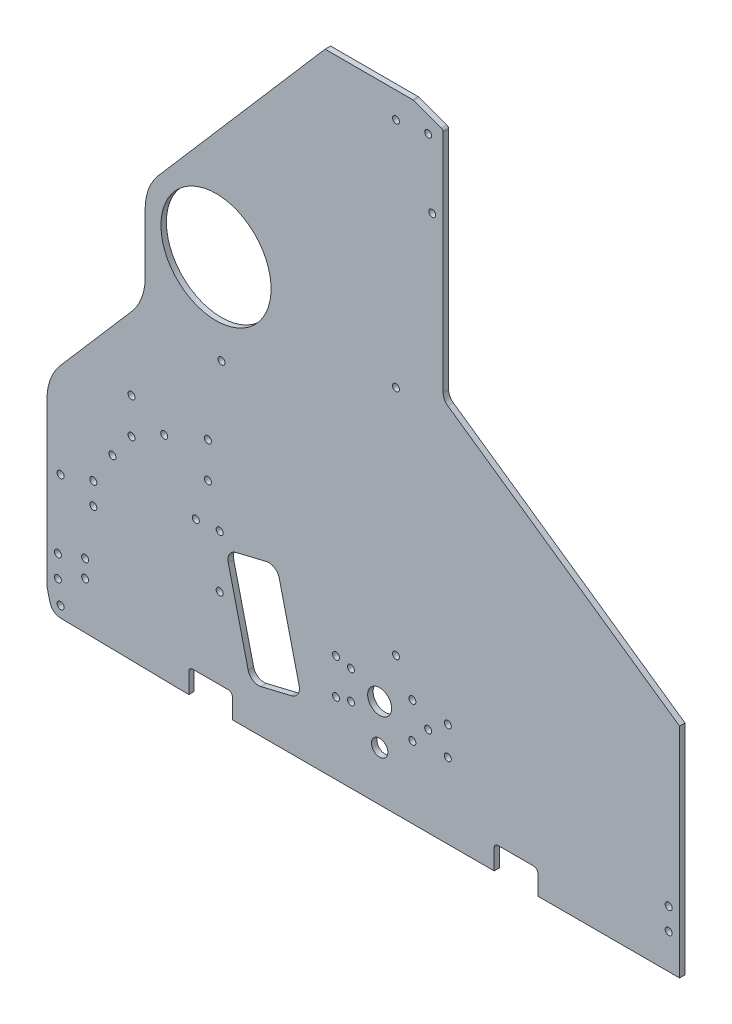
from build123d import *

# Parameters (mm, degrees)
SKETCH1_R           = 2.032
SKETCH1_R_2         = 2
BOSS_EXTRUDE1_DEPTH = 3.175
FILLET1_R           = 2.286
FILLET2_R           = 6.35
SKETCH2_R           = 2.032
CUT_EXTRUDE1_DEPTH  = 505.524983177
FILLET3_R           = 1.5875
SKETCH3_R           = 2.032
CUT_EXTRUDE2_DEPTH  = 505.524983177
SKETCH4_R           = 2.032
SKETCH4_R_2         = 6.985
SKETCH4_R_3         = 4.7625
CUT_EXTRUDE3_DEPTH  = 505.524983177
SKETCH5_R           = 32.0675
CUT_EXTRUDE5_DEPTH  = 540.282511023
FILLET4_R           = 31.75


with BuildPart() as part:
    # Sketch1 → Boss-Extrude1 (new body)
    with BuildSketch(Plane.XY):
        with BuildLine():
            Line((7.829508682, -19.049081656), (82.55, -20.32))
            Line((82.55, -20.32), (82.55, -6.35))
            Line((82.55, -6.35), (107.95, -6.35))
            Line((107.95, -6.35), (107.95, -20.32))
            Line((107.95, -20.32), (260.35, -20.32))
            Line((260.35, -20.32), (260.35, -6.35))
            Line((260.35, -6.35), (285.75, -6.35))
            Line((285.75, -6.35), (285.75, -20.32))
            Line((285.75, -20.32), (368.3, -20.32))
            Line((368.3, -20.32), (368.3, 106.68))
            Line((368.3, 106.68), (230.66375, 202.565))
            Line((230.66375, 202.565), (230.66375, 338.455))
            Line((230.66375, 338.455), (213.19998, 344.805))
            Line((213.19998, 344.805), (203.2, 344.805))
            Line((203.2, 344.805), (161.925, 344.805))
            Line((161.925, 344.805), (52.720122664, 218.469945827))
            ThreePointArc((52.720122664, 218.469945827), (52.803835479, 218.142145922), (52.832, 217.805))
            ThreePointArc((52.832, 217.805), (52.095493096, 216.239521914), (50.419872403, 215.808871996))
            Line((50.419872403, 215.808871996), (0, 157.48))
            Line((0, 157.48), (0, 0))
            Line((0, 0), (0, -6.35))
            ThreePointArc((0, -6.35), (0.047577015, -7.125863724), (0.189595124, -7.890101219))
            Line((0.189595124, -7.890101219), (1.777095124, -14.240101219))
            ThreePointArc((1.777095124, -14.240101219), (3.987212552, -17.671692778), (7.829508682, -19.049081656))
        make_face()
        with Locations((7.9375, -12.7)):
            Circle(SKETCH1_R, mode=Mode.SUBTRACT)
        with Locations((6.35, 0)):
            Circle(SKETCH1_R, mode=Mode.SUBTRACT)
        with Locations((6.35, 12.7)):
            Circle(SKETCH1_R, mode=Mode.SUBTRACT)
        with Locations((86.67844474, 70.151394807)):
            Circle(SKETCH1_R, mode=Mode.SUBTRACT)
        with Locations((38.1, 78.105)):
            Circle(SKETCH1_R, mode=Mode.SUBTRACT)
        with Locations((49.2125, 93.18625)):
            Circle(SKETCH1_R, mode=Mode.SUBTRACT)
        with Locations((68.2625, 103.505)):
            Circle(SKETCH1_R, mode=Mode.SUBTRACT)
        with Locations((49.2125, 113.82375)):
            Circle(SKETCH1_R, mode=Mode.SUBTRACT)
        with Locations((93.6625, 93.18625)):
            Circle(SKETCH1_R, mode=Mode.SUBTRACT)
        with Locations((93.6625, 113.82375)):
            Circle(SKETCH1_R, mode=Mode.SUBTRACT)
        with Locations((101.6, 157.48)):
            Circle(SKETCH1_R, mode=Mode.SUBTRACT)
        with Locations((203.2, 59.805)):
            Circle(SKETCH1_R_2, mode=Mode.SUBTRACT)
        with Locations((361.95, 0)):
            Circle(SKETCH1_R, mode=Mode.SUBTRACT)
        with Locations((361.95, 12.7)):
            Circle(SKETCH1_R, mode=Mode.SUBTRACT)
        with Locations((76.2, 217.805)):
            Circle(SKETCH1_R, mode=Mode.SUBTRACT)
        with Locations((203.2, 194.805)):
            Circle(SKETCH1_R_2, mode=Mode.SUBTRACT)
        with Locations((224.31375, 293.243)):
            Circle(SKETCH1_R, mode=Mode.SUBTRACT)
        with Locations((203.2, 329.805)):
            Circle(SKETCH1_R_2, mode=Mode.SUBTRACT)
        with Locations((221.931865, 332.105)):
            Circle(SKETCH1_R_2, mode=Mode.SUBTRACT)
    extrude(amount=BOSS_EXTRUDE1_DEPTH)

    # Fillet1
    fillet1_edges = [part.edges().sort_by_distance(p)[0] for p in [
        (285.75, -6.35, 1.5875),
        (107.95, -6.35, 1.5875),
        (260.35, -6.35, 1.5875),
        (82.55, -6.35, 1.5875),
    ]]
    fillet(fillet1_edges, radius=FILLET1_R)

    # Fillet2
    fillet2_edges = [part.edges().sort_by_distance(p)[0] for p in [
        (230.66375, 202.565, 1.5875),
    ]]
    fillet(fillet2_edges, radius=FILLET2_R)

    # Sketch2 → Cut-Extrude1 (cut, through all)
    with BuildSketch(Plane(origin=(0, 0, 0), x_dir=(-1, 0, 0), z_dir=(0, 0, -1))):
        with Locations((-100.552770272, 71.086035298)):
            Circle(SKETCH2_R)
        with Locations((-100.552770272, 40.606035298)):
            Circle(SKETCH2_R)
        with Locations((-22.225, 18.202541089)):
            Circle(SKETCH2_R)
        with Locations((-22.225, 8.042541089)):
            Circle(SKETCH2_R)
    extrude(amount=-CUT_EXTRUDE1_DEPTH, mode=Mode.SUBTRACT)

    # Fillet3
    fillet3_edges = [part.edges().sort_by_distance(p)[0] for p in [
        (230.66375, 338.455, 1.5875),
        (213.19998, 344.805, 1.5875),
    ]]
    fillet(fillet3_edges, radius=FILLET3_R)

    # Sketch3 → Cut-Extrude2 (cut, through all)
    with BuildSketch(Plane.XY.offset(3.175)):
        with BuildLine():
            Line((127.789362955, 69.359774106), (110.090763084, 65.117184968))
            ThreePointArc((110.090763084, 65.117184968), (106.2879526, 62.356288953), (105.551207814, 57.715047577))
            Line((105.551207814, 57.715047577), (117.160050619, 9.287010566))
            ThreePointArc((117.160050619, 9.287010566), (119.920946635, 5.484200083), (124.56218801, 4.747455297))
            Line((124.56218801, 4.747455297), (142.260787882, 8.990044434))
            ThreePointArc((142.260787882, 8.990044434), (146.063598365, 11.75094045), (146.800343151, 16.392181825))
            Line((146.800343151, 16.392181825), (135.191500346, 64.820218836))
            ThreePointArc((135.191500346, 64.820218836), (132.430604331, 68.62302932), (127.789362955, 69.359774106))
        make_face()
        with Locations((26.987500002, 46.953113935)):
            Circle(SKETCH3_R)
        with Locations((26.987500002, 59.653113935)):
            Circle(SKETCH3_R)
        with Locations((7.937500002, 53.303113935)):
            Circle(SKETCH3_R)
    extrude(amount=-CUT_EXTRUDE2_DEPTH, mode=Mode.SUBTRACT)

    # Sketch4 → Cut-Extrude3 (cut, through all)
    with BuildSketch(Plane.XY.offset(3.175)):
        with Locations((168.275, 42.06875)):
            Circle(SKETCH4_R)
        with Locations((212.725, 42.06875)):
            Circle(SKETCH4_R)
        with Locations((212.725, 21.43125)):
            Circle(SKETCH4_R)
        with Locations((168.275, 21.43125)):
            Circle(SKETCH4_R)
        with Locations((193.675, 31.75)):
            Circle(SKETCH4_R_2)
        with Locations((177.00498, 40.0431)):
            Circle(SKETCH4_R)
        with Locations((177.00498, 23.4569)):
            Circle(SKETCH4_R)
        with Locations((193.675, 8.466666658)):
            Circle(SKETCH4_R_3)
        with Locations((221.931865, 31.75)):
            Circle(SKETCH4_R)
        with Locations((233.36123, 23.4569)):
            Circle(SKETCH4_R)
        with Locations((233.36123, 40.0431)):
            Circle(SKETCH4_R)
    extrude(amount=-CUT_EXTRUDE3_DEPTH, mode=Mode.SUBTRACT)

    # Sketch5 → Cut-Extrude5 (cut, through all)
    with BuildSketch(Plane(origin=(0, 0, -187.32499651), x_dir=(-1, 0, 0), z_dir=(0, 0, -1))):
        Polygon((0, 157.48), (-57.15, 223.594705882), (-57.15, 165.333696112), (0, 99.218990229), align=None)
        with Locations((-98.425, 208.228121768)):
            Circle(SKETCH5_R)
    extrude(amount=-CUT_EXTRUDE5_DEPTH, mode=Mode.SUBTRACT)

    # Fillet4
    fillet4_edges = [part.edges().sort_by_distance(p)[0] for p in [
        (0, 99.218990229, 1.5875),
        (57.15, 165.333696112, 1.5875),
        (57.15, 223.594705882, 1.5875),
    ]]
    fillet(fillet4_edges, radius=FILLET4_R)


solid = part.part
